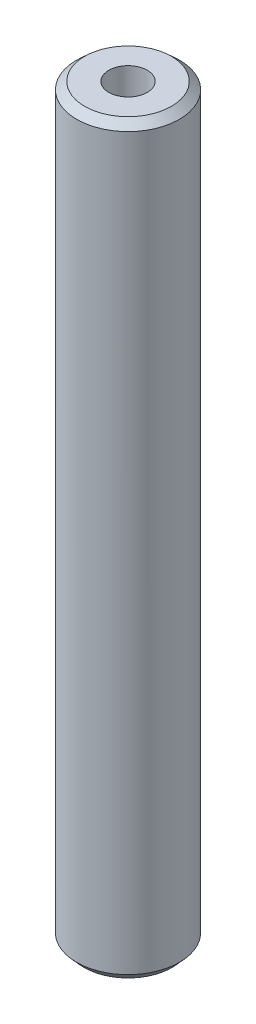
from build123d import *
from OCP.BRepFilletAPI import BRepFilletAPI_MakeChamfer

# Parameters (mm, degrees)
SKETCH1_R           = 20
BOSS_EXTRUDE1_DEPTH = 290.200484392
SKETCH2_R           = 7.485690037
CUT_EXTRUDE1_DEPTH  = 292.575583925
CHAMFER1_SIZE       = 2.822127277
CHAMFER1_SIZE2      = 3.125631448


with BuildPart() as part:
    # Sketch1 → Boss-Extrude1 (new body)
    with BuildSketch(Plane(origin=(0, 0, 0), x_dir=(1, 0, 0), z_dir=(0, 1, 0))):
        Circle(SKETCH1_R)
    extrude(amount=BOSS_EXTRUDE1_DEPTH)

    # Sketch2 → Cut-Extrude1 (cut, through all)
    with BuildSketch(Plane(origin=(0, 0, 0), x_dir=(1, 0, 0), z_dir=(0, 1, 0))):
        Circle(SKETCH2_R)
    extrude(amount=CUT_EXTRUDE1_DEPTH, mode=Mode.SUBTRACT)

    # Chamfer1: one chamfer whose edges measure the first distance from different faces: ONE call of the kernel's chamfer builder (chamfer() names one face for all edges)
    chamfer1_edges_1 = [part.edges().sort_by_distance(p)[0] for p in [
        (-20, 290.200484392, 0),
    ]]
    chamfer1_side_1 = [part.faces().sort_by_distance(p)[0] for p in [
        (-20, 145.100242196, 0),
    ]]
    chamfer1_edges_2 = [part.edges().sort_by_distance(p)[0] for p in [
        (-20, 0, 0),
    ]]
    chamfer1_side_2 = [part.faces().sort_by_distance(p)[0] for p in [
        (-19.434314575, 0, 0),
    ]]
    chamfer1 = BRepFilletAPI_MakeChamfer(part.part.solid().wrapped)
    for e in chamfer1_edges_1:
        chamfer1.Add(CHAMFER1_SIZE, CHAMFER1_SIZE2, e.wrapped, chamfer1_side_1[0].wrapped)  # the first distance lies on this face
    for e in chamfer1_edges_2:
        chamfer1.Add(CHAMFER1_SIZE, CHAMFER1_SIZE2, e.wrapped, chamfer1_side_2[0].wrapped)  # the first distance lies on this face
    add(Compound.cast(chamfer1.Shape()), mode=Mode.REPLACE)


solid = part.part
